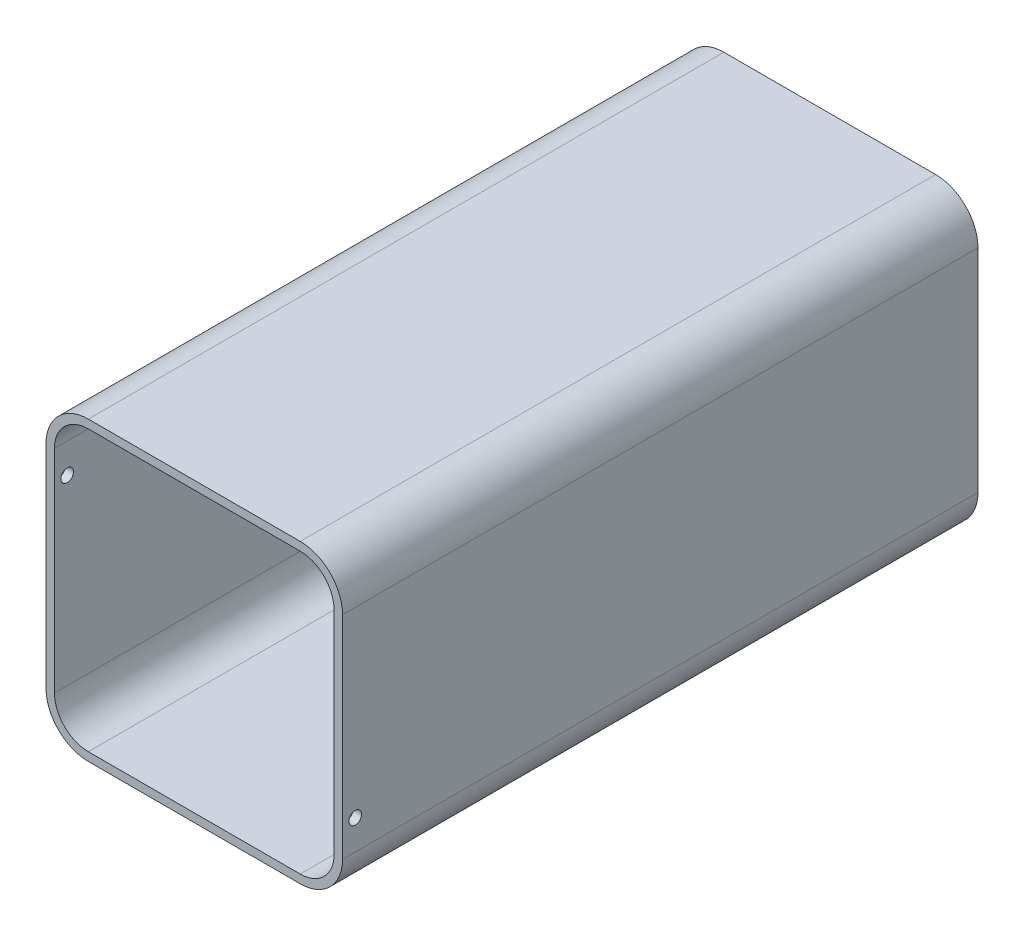
from build123d import *

# Parameters (mm, degrees)
EXTRUDE_1_DEPTH     = 150
SHELL_1_T           = -2
SKETCH_2_R          = 1.1
SKETCH_2_W          = 13.5
SKETCH_2_H          = 25
CUT_EXTRUDE_1_DEPTH = 150
SKETCH_3_W          = 11.907125669
SKETCH_3_H          = 29.749118518
CUT_EXTRUDE_2_DEPTH = 10
FILLET_1_R          = 2
FILLET_2_R          = 2
FILLET_3_R          = 2
FILLET_4_R          = 2
SKETCH_4_R          = 1.5
CUT_EXTRUDE_3_DEPTH = 7
SKETCH_5_R          = 1.5
CUT_EXTRUDE_4_DEPTH = 7


with BuildPart() as part:
    # 草图1 → 凸台-拉伸1 (new body)
    with BuildSketch(Plane.XY):
        with BuildLine():
            Line((-28.318229719, 20.413532085), (-28.318229719, -29.586467915))
            ThreePointArc((-28.318229719, -29.586467915), (-25.38929753, -36.657535727), (-18.318229719, -39.586467915))
            Line((-18.318229719, -39.586467915), (31.681770281, -39.586467915))
            ThreePointArc((31.681770281, -39.586467915), (38.752838093, -36.657535727), (41.681770281, -29.586467915))
            Line((41.681770281, -29.586467915), (41.681770281, 20.413532085))
            ThreePointArc((41.681770281, 20.413532085), (38.752838093, 27.484599896), (31.681770281, 30.413532085))
            Line((31.681770281, 30.413532085), (-18.318229719, 30.413532085))
            ThreePointArc((-18.318229719, 30.413532085), (-25.38929753, 27.484599896), (-28.318229719, 20.413532085))
        make_face()
    extrude(amount=EXTRUDE_1_DEPTH)

    # 抽壳1
    shell_1_openings = [part.faces().sort_by_distance(p)[0] for p in [
        (6.681770281, -4.586467915, 150),
    ]]
    offset(amount=SHELL_1_T, openings=shell_1_openings, kind=Kind.INTERSECTION)

    # 草图2 → 切除-拉伸1 (cut)
    with BuildSketch(Plane(origin=(0, 0, 0), x_dir=(-1, 0, 0), z_dir=(0, 0, -1))):
        with Locations((15.320445421, -18.486467915)):
            Circle(SKETCH_2_R)
        with Locations((14.820445421, 9.309035318)):
            Circle(SKETCH_2_R)
        with Locations((14.820445421, -4.586467915)):
            Rectangle(SKETCH_2_W, SKETCH_2_H)
    extrude(amount=-CUT_EXTRUDE_1_DEPTH, mode=Mode.SUBTRACT)

    # 草图3 → 切除-拉伸2 (cut)
    with BuildSketch(Plane(origin=(0, 0, 0), x_dir=(-1, 0, 0), z_dir=(0, 0, -1))):
        with Locations((-21.578307669, -5.268329048)):
            Rectangle(SKETCH_3_W, SKETCH_3_H)
    extrude(amount=-CUT_EXTRUDE_2_DEPTH, mode=Mode.SUBTRACT)

    # 圆角1
    fillet_1_edges = [part.edges().sort_by_distance(p)[0] for p in [
        (15.624744835, 9.606230211, 1),
    ]]
    fillet(fillet_1_edges, radius=FILLET_1_R)

    # 圆角2
    fillet_2_edges = [part.edges().sort_by_distance(p)[0] for p in [
        (15.624744835, -20.142888307, 1),
    ]]
    fillet(fillet_2_edges, radius=FILLET_2_R)

    # 圆角3
    fillet_3_edges = [part.edges().sort_by_distance(p)[0] for p in [
        (27.531870504, -20.142888307, 1),
    ]]
    fillet(fillet_3_edges, radius=FILLET_3_R)

    # 圆角4
    fillet_4_edges = [part.edges().sort_by_distance(p)[0] for p in [
        (27.531870504, 9.606230211, 1),
    ]]
    fillet(fillet_4_edges, radius=FILLET_4_R)

    # 草图4 → 切除-拉伸3 (cut)
    with BuildSketch(Plane.ZY.offset(-39.681770281)):
        with Locations((147, -22.586467915)):
            Circle(SKETCH_4_R)
    extrude(amount=-CUT_EXTRUDE_3_DEPTH, mode=Mode.SUBTRACT)

    # 草图5 → 切除-拉伸4 (cut)
    with BuildSketch(Plane(origin=(-26.318229719, 0, 0), x_dir=(0, 0, -1), z_dir=(1, 0, 0))):
        with Locations((-147, 13.413532085)):
            Circle(SKETCH_5_R)
    extrude(amount=-CUT_EXTRUDE_4_DEPTH, mode=Mode.SUBTRACT)


solid = part.part
